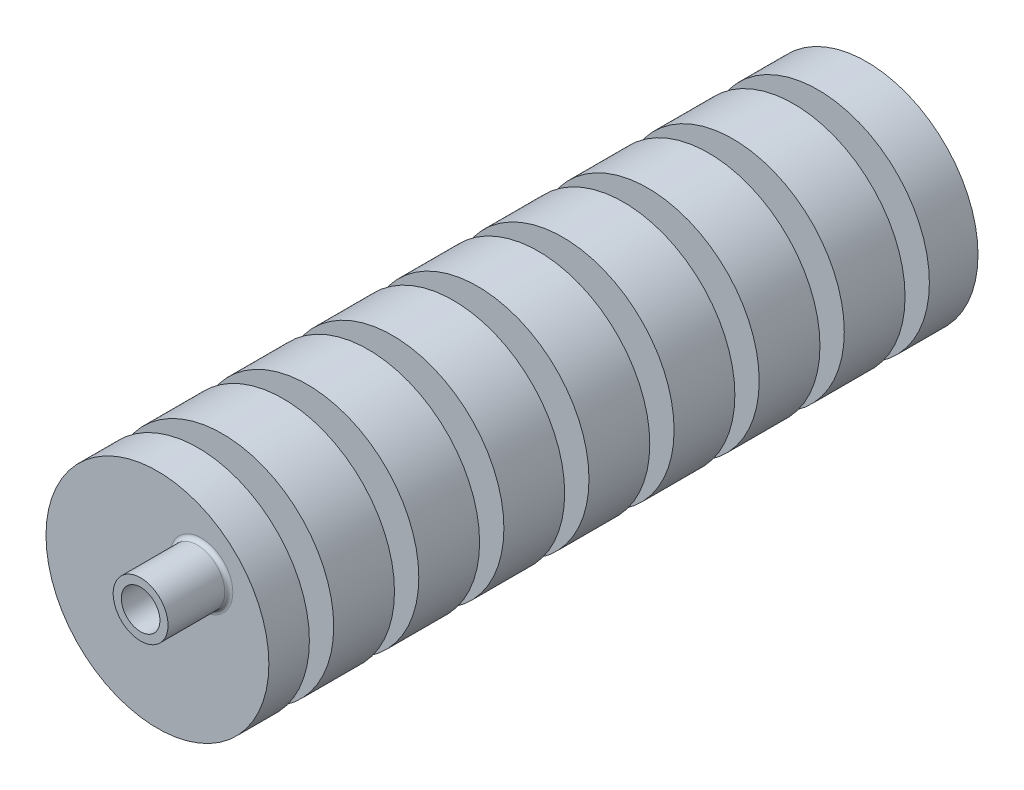
from build123d import *

# Parameters (mm, degrees)
SKETCH3_R             = 27.5
BOSS_EXTRUDE2_DEPTH   = 175
SKETCH5_R             = 3.175
CUT_EXTRUDE1_DEPTH    = 180.26935042
SKETCH4_W             = 16
SKETCH4_H             = 6
SHELL1_START          = 3
SHELL1_OUTLINE_R      = 8.5
SHELL1_OUTLINE_R_2    = 6.175
SHELL1_DEPTH          = 169
SHELL1_START_2        = 21
SHELL1_2_OUTLINE_R    = 24.5
SHELL1_2_OUTLINE_R_2  = 8.5
SHELL1_2_DEPTH        = 9
SHELL1_START_3        = 42
SHELL1_3_OUTLINE_R    = 24.5
SHELL1_3_OUTLINE_R_2  = 8.5
SHELL1_3_DEPTH        = 9
SHELL1_START_4        = 63
SHELL1_4_OUTLINE_R    = 24.5
SHELL1_4_OUTLINE_R_2  = 8.5
SHELL1_4_DEPTH        = 9
SHELL1_START_5        = 84
SHELL1_5_OUTLINE_R    = 24.5
SHELL1_5_OUTLINE_R_2  = 8.5
SHELL1_5_DEPTH        = 9
SHELL1_START_6        = 105
SHELL1_6_OUTLINE_R    = 24.5
SHELL1_6_OUTLINE_R_2  = 8.5
SHELL1_6_DEPTH        = 9
SHELL1_START_7        = 126
SHELL1_7_OUTLINE_R    = 24.5
SHELL1_7_OUTLINE_R_2  = 8.5
SHELL1_7_DEPTH        = 9
SHELL1_START_8        = 147
SHELL1_8_OUTLINE_R    = 24.5
SHELL1_8_OUTLINE_R_2  = 8.5
SHELL1_8_DEPTH        = 9
SHELL1_9_OUTLINE_R    = 24.5
SHELL1_9_OUTLINE_R_2  = 8.5
SHELL1_9_DEPTH        = 6
SHELL1_START_9        = 168
SHELL1_10_OUTLINE_R   = 24.5
SHELL1_10_OUTLINE_R_2 = 8.5
SHELL1_10_DEPTH       = 4
BOSS_EXTRUDE3_REACH   = 181.269
SKETCH11_W            = 6
SKETCH11_H            = 18.622661507
SKETCH11_H_2          = 18.562635142
SKETCH11_H_3          = 18.723636058
SKETCH11_H_4          = 19.102872432
SKETCH11_H_5          = 19.443952445
SKETCH11_H_6          = 20.46765219
SKETCH11_H_7          = 19.166783548
SKETCH11_H_8          = 20.128295153
SKETCH12_W            = 1.25
SKETCH12_H            = 4
SKETCH12_H_2          = 6
SKETCH12_H_3          = 9
SKETCH13_R            = 6.7625
SKETCH13_R_2          = 4.7625
BOSS_EXTRUDE4_DEPTH   = 15
CUT_EXTRUDE2_START    = -18
SKETCH14_R            = 4.7625
CUT_EXTRUDE2_DEPTH    = 18
FILLET1_R             = 1


# Read off the part's stored shape, not the designer's step: Shell1
with BuildPart() as part:
    # Sketch3 → Boss-Extrude2 (new body)
    with BuildSketch(Plane.XY):
        Circle(SKETCH3_R)
    extrude(amount=BOSS_EXTRUDE2_DEPTH)

    # Sketch5 → Cut-Extrude1 (cut, through all)
    with BuildSketch(Plane.XY.offset(175)):
        Circle(SKETCH5_R)
    extrude(amount=-CUT_EXTRUDE1_DEPTH, mode=Mode.SUBTRACT)

    # Sketch4 → Cut-Revolve1 (revolve, cut)
    with BuildSketch(Plane(origin=(0, 0, 0), x_dir=(1, 0, 0), z_dir=(0, 1, 0)), mode=Mode.PRIVATE) as cut_revolve1_sk:
        with Locations((-19.5, -162)):
            Rectangle(SKETCH4_W, SKETCH4_H)
        with Locations((-19.5, -141)):
            Rectangle(SKETCH4_W, SKETCH4_H)
        with Locations((-19.5, -120)):
            Rectangle(SKETCH4_W, SKETCH4_H)
        with Locations((-19.5, -99)):
            Rectangle(SKETCH4_W, SKETCH4_H)
        with Locations((-19.5, -78)):
            Rectangle(SKETCH4_W, SKETCH4_H)
        with Locations((-19.5, -57)):
            Rectangle(SKETCH4_W, SKETCH4_H)
        with Locations((-19.5, -36)):
            Rectangle(SKETCH4_W, SKETCH4_H)
        with Locations((-19.5, -15)):
            Rectangle(SKETCH4_W, SKETCH4_H)
    revolve(cut_revolve1_sk.sketch.rotate(Axis((0, 0, 175), (0, 0, -1)), 180), axis=Axis((0, 0, 175), (0, 0, -1)), mode=Mode.SUBTRACT)

    # Shell1 outline → Shell1 (cut)
    with BuildSketch(Plane.XY.offset(SHELL1_START)):
        Circle(SHELL1_OUTLINE_R)
        Circle(SHELL1_OUTLINE_R_2, mode=Mode.SUBTRACT)
    extrude(amount=SHELL1_DEPTH, mode=Mode.SUBTRACT)

    # Shell1 2 outline → Shell1 2 (cut)
    with BuildSketch(Plane.XY.offset(SHELL1_START_2)):
        Circle(SHELL1_2_OUTLINE_R)
        Circle(SHELL1_2_OUTLINE_R_2, mode=Mode.SUBTRACT)
    extrude(amount=SHELL1_2_DEPTH, mode=Mode.SUBTRACT)

    # Shell1 3 outline → Shell1 3 (cut)
    with BuildSketch(Plane.XY.offset(SHELL1_START_3)):
        Circle(SHELL1_3_OUTLINE_R)
        Circle(SHELL1_3_OUTLINE_R_2, mode=Mode.SUBTRACT)
    extrude(amount=SHELL1_3_DEPTH, mode=Mode.SUBTRACT)

    # Shell1 4 outline → Shell1 4 (cut)
    with BuildSketch(Plane.XY.offset(SHELL1_START_4)):
        Circle(SHELL1_4_OUTLINE_R)
        Circle(SHELL1_4_OUTLINE_R_2, mode=Mode.SUBTRACT)
    extrude(amount=SHELL1_4_DEPTH, mode=Mode.SUBTRACT)

    # Shell1 5 outline → Shell1 5 (cut)
    with BuildSketch(Plane.XY.offset(SHELL1_START_5)):
        Circle(SHELL1_5_OUTLINE_R)
        Circle(SHELL1_5_OUTLINE_R_2, mode=Mode.SUBTRACT)
    extrude(amount=SHELL1_5_DEPTH, mode=Mode.SUBTRACT)

    # Shell1 6 outline → Shell1 6 (cut)
    with BuildSketch(Plane.XY.offset(SHELL1_START_6)):
        Circle(SHELL1_6_OUTLINE_R)
        Circle(SHELL1_6_OUTLINE_R_2, mode=Mode.SUBTRACT)
    extrude(amount=SHELL1_6_DEPTH, mode=Mode.SUBTRACT)

    # Shell1 7 outline → Shell1 7 (cut)
    with BuildSketch(Plane.XY.offset(SHELL1_START_7)):
        Circle(SHELL1_7_OUTLINE_R)
        Circle(SHELL1_7_OUTLINE_R_2, mode=Mode.SUBTRACT)
    extrude(amount=SHELL1_7_DEPTH, mode=Mode.SUBTRACT)

    # Shell1 8 outline → Shell1 8 (cut)
    with BuildSketch(Plane.XY.offset(SHELL1_START_8)):
        Circle(SHELL1_8_OUTLINE_R)
        Circle(SHELL1_8_OUTLINE_R_2, mode=Mode.SUBTRACT)
    extrude(amount=SHELL1_8_DEPTH, mode=Mode.SUBTRACT)

    # Shell1 9 outline → Shell1 9 (cut)
    with BuildSketch(Plane.XY.offset(SHELL1_START)):
        Circle(SHELL1_9_OUTLINE_R)
        Circle(SHELL1_9_OUTLINE_R_2, mode=Mode.SUBTRACT)
    extrude(amount=SHELL1_9_DEPTH, mode=Mode.SUBTRACT)

    # Shell1 10 outline → Shell1 10 (cut)
    with BuildSketch(Plane.XY.offset(SHELL1_START_9)):
        Circle(SHELL1_10_OUTLINE_R)
        Circle(SHELL1_10_OUTLINE_R_2, mode=Mode.SUBTRACT)
    extrude(amount=SHELL1_10_DEPTH, mode=Mode.SUBTRACT)

    # Boss-Extrude3: up to this face of the body (flat: up to its plane)
    boss_extrude3_end = Plane(part.part.faces().sort_by_distance((-26.722182541, 0, 175))[0])
    # Sketch10 → Boss-Extrude3 (add, up to the picked face)
    with BuildSketch(Plane(origin=(0, 0, 0), x_dir=(-1, 0, 0), z_dir=(0, 0, -1)), mode=Mode.PRIVATE) as boss_extrude3_sk1:
        with BuildLine():
            Line((-1, 27.481812167), (-1, 3.01340754))
            ThreePointArc((-1, 3.01340754), (0, 3.175), (1, 3.01340754))
            Line((1, 3.01340754), (1, 27.481812167))
            ThreePointArc((1, 27.481812167), (0, 27.5), (-1, 27.481812167))
        make_face()
    boss_extrude3_tool1 = split(extrude(boss_extrude3_sk1.sketch, amount=-BOSS_EXTRUDE3_REACH, mode=Mode.PRIVATE), bisect_by=boss_extrude3_end, keep=Keep.BOTH, mode=Mode.PRIVATE)
    # Sketch10 → Boss-Extrude3 (add, up to the picked face)
    with BuildSketch(Plane(origin=(0, 0, 0), x_dir=(-1, 0, 0), z_dir=(0, 0, -1)), mode=Mode.PRIVATE) as boss_extrude3_sk2:
        with BuildLine():
            Line((3.01340754, 1), (27.481812167, 1))
            ThreePointArc((27.481812167, 1), (27.5, 0), (27.481812167, -1))
            Line((27.481812167, -1), (3.01340754, -1))
            ThreePointArc((3.01340754, -1), (3.175, 0), (3.01340754, 1))
        make_face()
    boss_extrude3_tool2 = split(extrude(boss_extrude3_sk2.sketch, amount=-BOSS_EXTRUDE3_REACH, mode=Mode.PRIVATE), bisect_by=boss_extrude3_end, keep=Keep.BOTH, mode=Mode.PRIVATE)
    # Sketch10 → Boss-Extrude3 (add, up to the picked face)
    with BuildSketch(Plane(origin=(0, 0, 0), x_dir=(-1, 0, 0), z_dir=(0, 0, -1)), mode=Mode.PRIVATE) as boss_extrude3_sk3:
        with BuildLine():
            Line((-1, -3.01340754), (-1, -27.481812167))
            ThreePointArc((-1, -27.481812167), (0, -27.5), (1, -27.481812167))
            Line((1, -27.481812167), (1, -3.01340754))
            ThreePointArc((1, -3.01340754), (0, -3.175), (-1, -3.01340754))
        make_face()
    boss_extrude3_tool3 = split(extrude(boss_extrude3_sk3.sketch, amount=-BOSS_EXTRUDE3_REACH, mode=Mode.PRIVATE), bisect_by=boss_extrude3_end, keep=Keep.BOTH, mode=Mode.PRIVATE)
    # Sketch10 → Boss-Extrude3 (add, up to the picked face)
    with BuildSketch(Plane(origin=(0, 0, 0), x_dir=(-1, 0, 0), z_dir=(0, 0, -1)), mode=Mode.PRIVATE) as boss_extrude3_sk4:
        with BuildLine():
            Line((-27.481812167, -1), (-3.01340754, -1))
            ThreePointArc((-3.01340754, -1), (-3.175, 0), (-3.01340754, 1))
            Line((-3.01340754, 1), (-27.481812167, 1))
            ThreePointArc((-27.481812167, 1), (-27.5, 0), (-27.481812167, -1))
        make_face()
    boss_extrude3_tool4 = split(extrude(boss_extrude3_sk4.sketch, amount=-BOSS_EXTRUDE3_REACH, mode=Mode.PRIVATE), bisect_by=boss_extrude3_end, keep=Keep.BOTH, mode=Mode.PRIVATE)
    add(boss_extrude3_tool1.solids().sort_by(Axis((0, 15.307771, 0), (0, 0, 1)))[0])
    add(boss_extrude3_tool2.solids().sort_by(Axis((-15.307771, 0, 0), (0, 0, 1)))[0])
    add(boss_extrude3_tool3.solids().sort_by(Axis((0, -15.307771, 0), (0, 0, 1)))[0])
    add(boss_extrude3_tool4.solids().sort_by(Axis((15.307771, 0, 0), (0, 0, 1)))[0])

    # Sketch11 → Cut-Revolve2 (revolve, cut)
    with BuildSketch(Plane(origin=(0, 0, 0), x_dir=(0, 0, -1), z_dir=(1, 0, 0)), mode=Mode.PRIVATE) as cut_revolve2_sk:
        with Locations((-162, 20.76776999)):
            Rectangle(SKETCH11_W, SKETCH11_H)
        with Locations((-141, 20.737756808)):
            Rectangle(SKETCH11_W, SKETCH11_H_2)
        with Locations((-120, 20.837335447)):
            Rectangle(SKETCH11_W, SKETCH11_H_3)
        with Locations((-99, 21.007875453)):
            Rectangle(SKETCH11_W, SKETCH11_H_4)
        with Locations((-78, 21.197493641)):
            Rectangle(SKETCH11_W, SKETCH11_H_5)
        with Locations((-57, 21.690265332)):
            Rectangle(SKETCH11_W, SKETCH11_H_6)
        with Locations((-36, 21.039831011)):
            Rectangle(SKETCH11_W, SKETCH11_H_7)
        with Locations((-15, 21.520586814)):
            Rectangle(SKETCH11_W, SKETCH11_H_8)
    revolve(cut_revolve2_sk.sketch.rotate(Axis((0, 0, 174.128746248), (0, 0, -1)), 90), axis=Axis((0, 0, 174.128746248), (0, 0, -1)), mode=Mode.SUBTRACT)

    # Sketch12 → Revolve1 (revolve)
    with BuildSketch(Plane(origin=(0, 0, 0), x_dir=(1, 0, 0), z_dir=(0, 1, 0))):
        with Locations((24.10458333, -170)):
            Rectangle(SKETCH12_W, SKETCH12_H)
        with Locations((24.10458333, -6)):
            Rectangle(SKETCH12_W, SKETCH12_H_2)
        with Locations((24.10458333, -151.5)):
            Rectangle(SKETCH12_W, SKETCH12_H_3)
        with Locations((24.10458333, -130.5)):
            Rectangle(SKETCH12_W, SKETCH12_H_3)
        with Locations((24.10458333, -109.5)):
            Rectangle(SKETCH12_W, SKETCH12_H_3)
        with Locations((24.10458333, -88.5)):
            Rectangle(SKETCH12_W, SKETCH12_H_3)
        with Locations((24.10458333, -67.5)):
            Rectangle(SKETCH12_W, SKETCH12_H_3)
        with Locations((24.10458333, -46.5)):
            Rectangle(SKETCH12_W, SKETCH12_H_3)
        with Locations((24.10458333, -25.5)):
            Rectangle(SKETCH12_W, SKETCH12_H_3)
    revolve(axis=Axis((0, 0, 0), (0, 0, 1)))

    # Sketch13 → Boss-Extrude4 (add)
    with BuildSketch(Plane.XY.offset(175)):
        with Locations((10.845250256, 10.845250256)):
            Circle(SKETCH13_R)
        with Locations((10.845250256, 10.845250256)):
            Circle(SKETCH13_R_2, mode=Mode.SUBTRACT)
    extrude(amount=BOSS_EXTRUDE4_DEPTH)

    # Sketch14 → Cut-Extrude2 (cut)
    with BuildSketch(Plane.XY.offset(190).offset(CUT_EXTRUDE2_START)):
        with Locations((10.845250256, 10.845250256)):
            Circle(SKETCH14_R)
    extrude(amount=CUT_EXTRUDE2_DEPTH, mode=Mode.SUBTRACT)

    # Fillet1
    fillet1_edges = [part.edges().sort_by_distance(p)[0] for p in [
        (4.082750256, 10.845250256, 175),
    ]]
    fillet(fillet1_edges, radius=FILLET1_R)


solid = part.part
